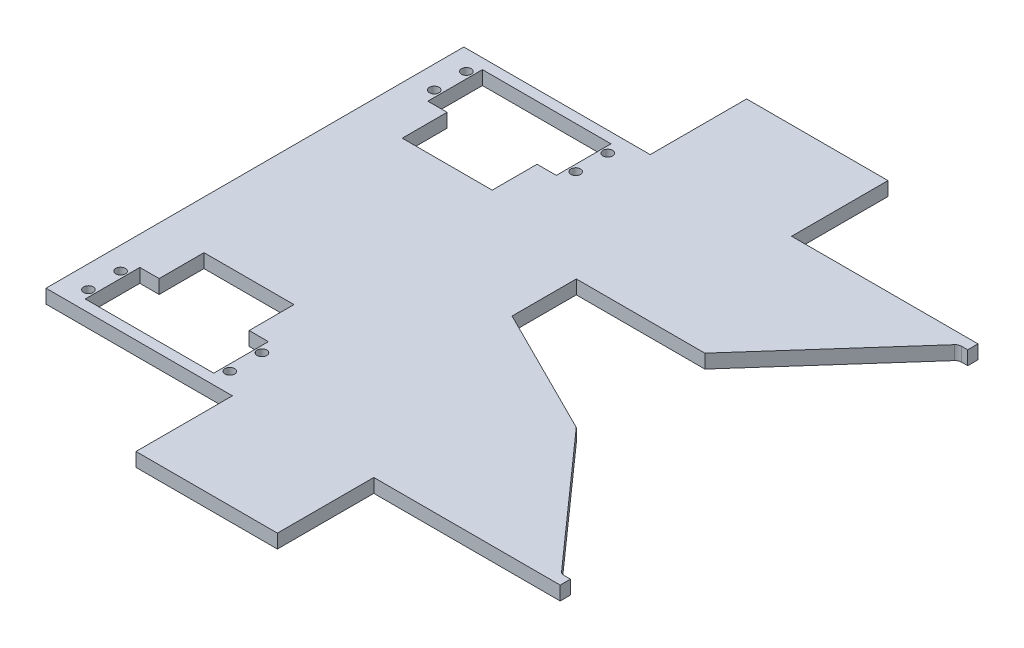
from build123d import *

# Parameters (mm, degrees)
BOSS_EXTRUDE1_DEPTH = 4.3
CUT_EXTRUDE1_DEPTH  = 4.5
FILLET1_R           = 2
CUT_EXTRUDE2_DEPTH  = 10
SKETCH8_R           = 1.5
CUT_EXTRUDE3_DEPTH  = 10


with BuildPart() as part:
    # Sketch2 → Boss-Extrude1 (new body)
    with BuildSketch(Plane(origin=(0, 0, 0), x_dir=(1, 0, 0), z_dir=(0, 1, 0))):
        Polygon((0, 0), (0, 65), (58, 65), (58, 95), (102, 95), (102, 65), (160, 65), (160, 0), align=None)
    extrude(amount=BOSS_EXTRUDE1_DEPTH)

    # Mirror1: part across plane


with BuildPart() as part_1:
    add(part.part)
    add(part.part.mirror(Plane(origin=(0, 4.3, 0), x_dir=(1, 0, 0), z_dir=(0, 0, -1))))

    # Sketch3 → Cut-Extrude1 (cut)
    with BuildSketch(Plane(origin=(0, 4.3, 0), x_dir=(1, 0, 0), z_dir=(0, 1, 0))):
        Polygon((160, -61.8), (160, 61.8), (157.156451185, 61.8), (120.012594795, 20), (80.012594795, 20), (80.012594795, 0), (120, -20), (157.155555556, -61.8), align=None)
    extrude(amount=-CUT_EXTRUDE1_DEPTH, mode=Mode.SUBTRACT)

    # Fillet1
    fillet1_edges = [part_1.edges().sort_by_distance(p)[0] for p in [
        (157.156451185, 2.15, -61.8),
        (157.155555556, 2.15, 61.8),
    ]]
    fillet(fillet1_edges, radius=FILLET1_R)

    # Sketch6 → Cut-Extrude2 (cut)
    with BuildSketch(Plane(origin=(0, 4.3, 0), x_dir=(1, 0, 0), z_dir=(0, 1, 0))):
        Polygon((9, -61.8), (49, -61.8), (49, -44.8), (43, -44.8), (43, -30.841820122), (15, -30.841820122), (15, -44.8), (9, -44.8), align=None)
        Polygon((9, 44.8), (15, 44.8), (15, 30.841820122), (43, 30.841820122), (43, 44.8), (49, 44.8), (49, 61.8), (9, 61.8), align=None)
    extrude(amount=-CUT_EXTRUDE2_DEPTH, mode=Mode.SUBTRACT)

    # Sketch8 → Cut-Extrude3 (cut)
    with BuildSketch(Plane(origin=(0, 4.3, 0), x_dir=(1, 0, 0), z_dir=(0, 1, 0))):
        with Locations((7, 58.8)):
            Circle(SKETCH8_R)
        with Locations((7, 48.8)):
            Circle(SKETCH8_R)
        with Locations((51, 48.8)):
            Circle(SKETCH8_R)
        with Locations((51, 58.8)):
            Circle(SKETCH8_R)
        with Locations((7, -48.8)):
            Circle(SKETCH8_R)
        with Locations((7, -58.8)):
            Circle(SKETCH8_R)
        with Locations((51, -58.8)):
            Circle(SKETCH8_R)
        with Locations((51, -48.8)):
            Circle(SKETCH8_R)
    extrude(amount=-CUT_EXTRUDE3_DEPTH, mode=Mode.SUBTRACT)


solid = part_1.part
